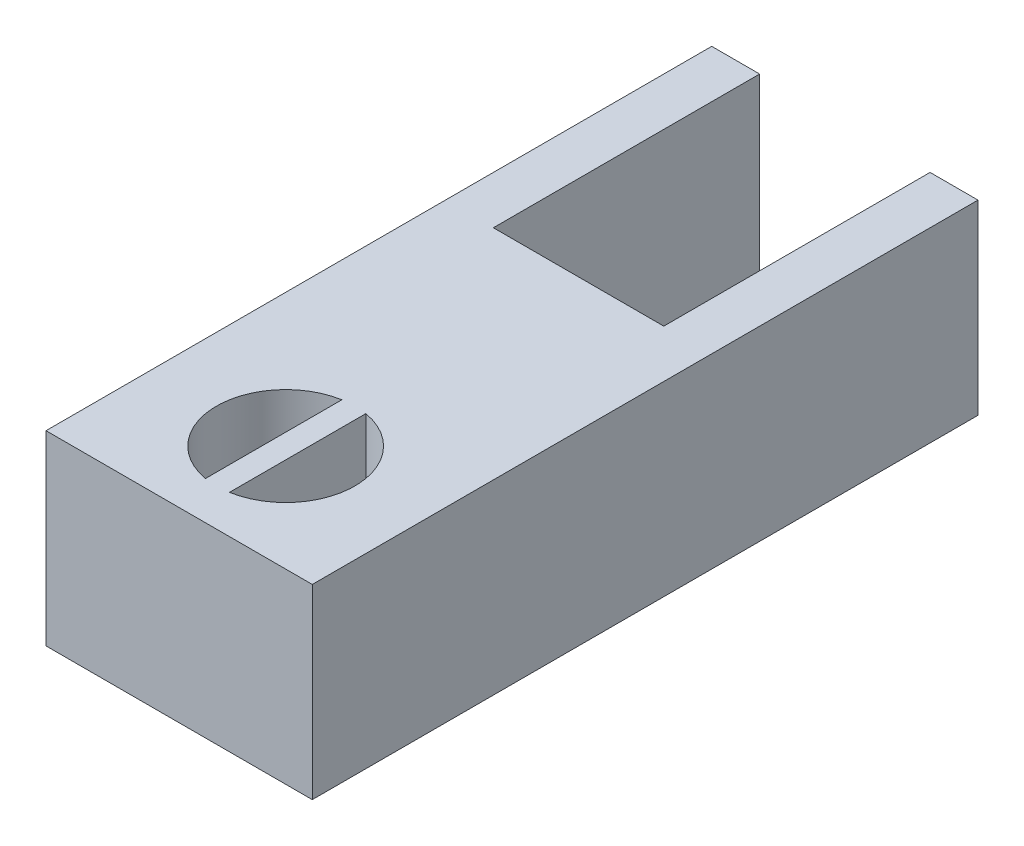
from build123d import *

# Parameters (mm, degrees)
SKETCH1_W           = 12.7
SKETCH1_H           = 31.75
BOSS_EXTRUDE1_DEPTH = 8.89
SKETCH2_W           = 8.128
SKETCH2_H           = 12.7
CUT_EXTRUDE1_DEPTH  = 8.89


with BuildPart() as part:
    # Sketch1 → Boss-Extrude1 (new body)
    with BuildSketch(Plane(origin=(0, 0, 0), x_dir=(1, 0, 0), z_dir=(0, 1, 0))):
        with Locations((6.35, 15.875)):
            Rectangle(SKETCH1_W, SKETCH1_H)
    extrude(amount=BOSS_EXTRUDE1_DEPTH)

    # Sketch2 → Cut-Extrude1 (cut)
    with BuildSketch(Plane(origin=(0, 8.89, 0), x_dir=(1, 0, 0), z_dir=(0, 1, 0))):
        with Locations((6.35, 25.4)):
            Rectangle(SKETCH2_W, SKETCH2_H)
        with BuildLine():
            Line((5.7785, 1.827832761), (5.7785, 8.332167239))
            ThreePointArc((5.7785, 8.332167239), (3.048, 5.08), (5.7785, 1.827832761))
        make_face()
        with BuildLine():
            ThreePointArc((6.9215, 1.827832761), (9.652, 5.08), (6.9215, 8.332167239))
            Line((6.9215, 8.332167239), (6.9215, 1.827832761))
        make_face()
    extrude(amount=-CUT_EXTRUDE1_DEPTH, mode=Mode.SUBTRACT)


solid = part.part
